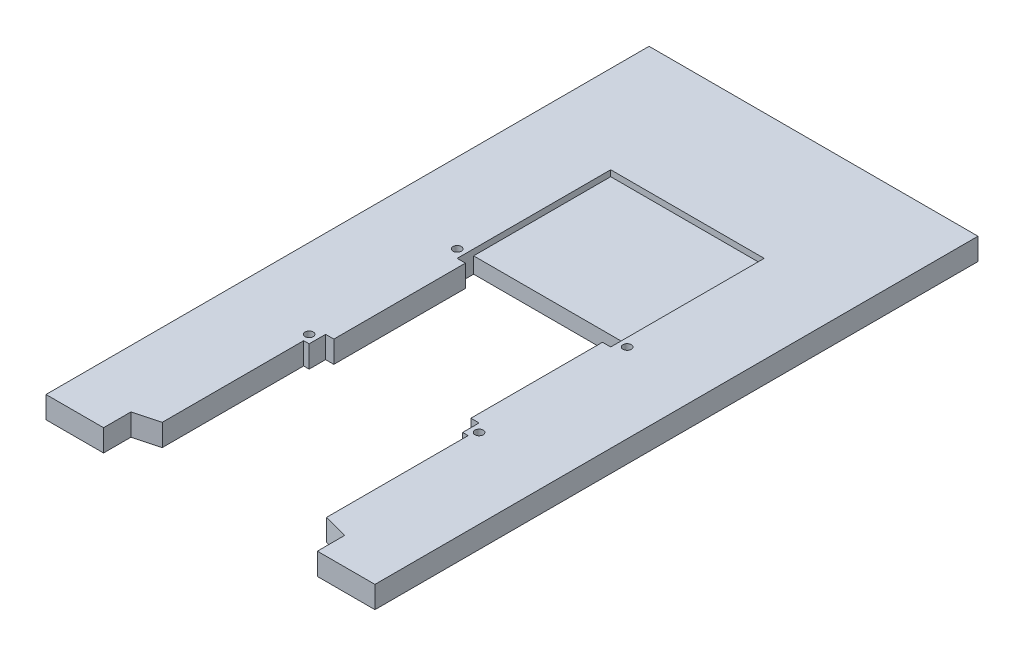
from build123d import *

# Parameters (mm, degrees)
SKETCH1_R           = 1.5
BOSS_EXTRUDE1_DEPTH = 8
SKETCH2_W           = 56
SKETCH2_H           = 50
CUT_EXTRUDE1_DEPTH  = 2.2


with BuildPart() as part:
    # Sketch1 → Boss-Extrude1 (new body)
    with BuildSketch(Plane(origin=(0, 0, 0), x_dir=(1, 0, 0), z_dir=(0, 1, 0))):
        Polygon((-30, 12.411542732), (-30, 64), (-28, 64), (-28, 70), (-25, 70), (-25, 118), (-28, 118), (-28, 124), (28, 124), (28, 118), (25, 118), (25, 70), (28, 70), (28, 64), (30, 64), (30, 12.411542732), (39, 10), (39, 0), (60, 0), (60, 220), (-60, 220), (-60, 0), (-39, 0), (-39, 10), align=None)
        with Locations((-31, 67)):
            Circle(SKETCH1_R, mode=Mode.SUBTRACT)
        with Locations((31, 67)):
            Circle(SKETCH1_R, mode=Mode.SUBTRACT)
        with Locations((-31, 121)):
            Circle(SKETCH1_R, mode=Mode.SUBTRACT)
        with Locations((31, 121)):
            Circle(SKETCH1_R, mode=Mode.SUBTRACT)
    extrude(amount=BOSS_EXTRUDE1_DEPTH)

    # Sketch2 → Cut-Extrude1 (cut)
    with BuildSketch(Plane(origin=(0, 8, 0), x_dir=(1, 0, 0), z_dir=(0, 1, 0))):
        with Locations((0, 149)):
            Rectangle(SKETCH2_W, SKETCH2_H)
    extrude(amount=-CUT_EXTRUDE1_DEPTH, mode=Mode.SUBTRACT)


solid = part.part
